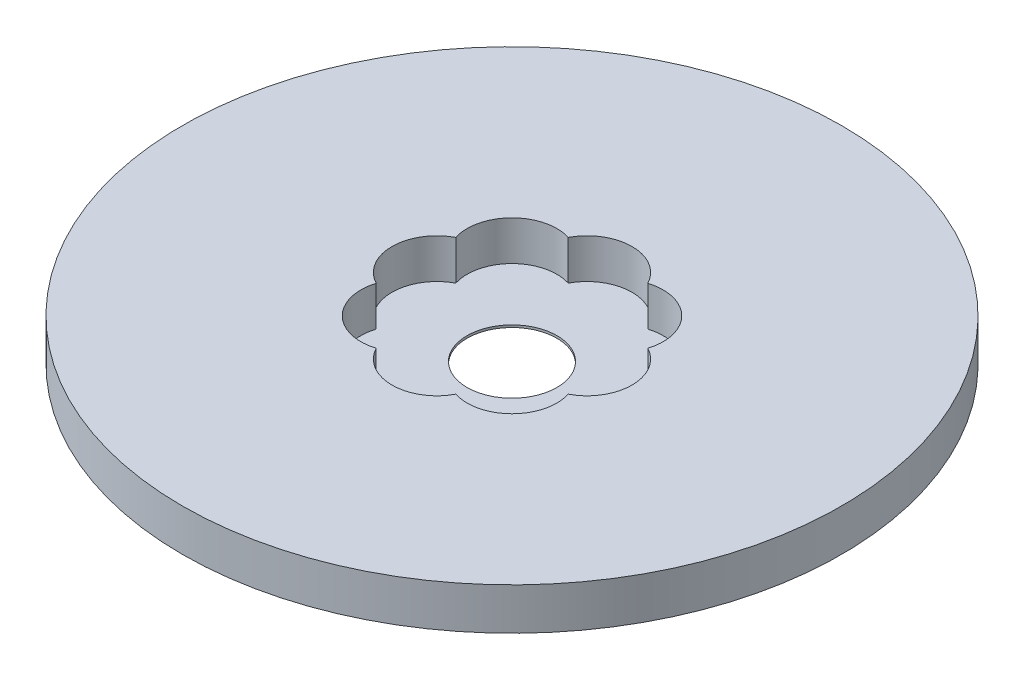
from build123d import *

# Parameters (mm, degrees)
SKETCH1_R           = 55
BOSS_EXTRUDE1_DEPTH = 7
SKETCH2_R           = 7.5
CUT_EXTRUDE1_DEPTH  = 79.096094653
SKETCH3_R           = 7.498426304
CUT_EXTRUDE2_DEPTH  = 6.613760509
CIRPATTERN1_COUNT   = 8


with BuildPart() as part:
    # Sketch1 → Boss-Extrude1 (new body)
    with BuildSketch(Plane(origin=(0, 0, 0), x_dir=(1, 0, 0), z_dir=(0, 1, 0))):
        Circle(SKETCH1_R)
    extrude(amount=BOSS_EXTRUDE1_DEPTH)

    # Sketch2 → Cut-Extrude1 (cut, through all)
    with BuildSketch(Plane(origin=(0, 0, 0), x_dir=(1, 0, 0), z_dir=(0, 1, 0))):
        Circle(SKETCH2_R)
    extrude(amount=CUT_EXTRUDE1_DEPTH, mode=Mode.SUBTRACT)

    # Sketch3 → Cut-Extrude2 (cut)
    with BuildSketch(Plane(origin=(0, 7, 0), x_dir=(1, 0, 0), z_dir=(0, 1, 0))):
        with Locations((-12.533826151, 0)):
            Circle(SKETCH3_R)
    cut_extrude2 = extrude(amount=-CUT_EXTRUDE2_DEPTH, mode=Mode.SUBTRACT)

    # CirPattern1: Cut-Extrude2 ×8 about axis
    cirpattern1_axis = Axis((0, 0, 0), (0, 1, 0))
    for i in range(1, CIRPATTERN1_COUNT):
        add(cut_extrude2.rotate(cirpattern1_axis, i * 360 / CIRPATTERN1_COUNT), mode=Mode.SUBTRACT)


solid = part.part
